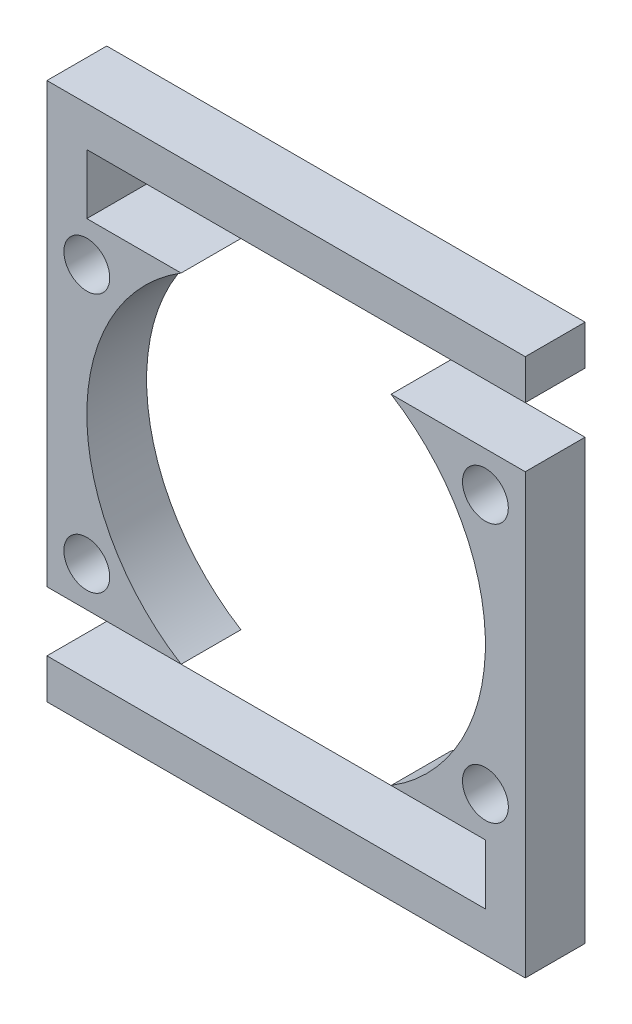
from build123d import *

# Parameters (mm, degrees)
SKETCH2_R             = 1.15
BOSS_EXTRUDE1_DEPTH   = 3
BOSS_EXTRUDE1_2_DEPTH = 3


with BuildPart() as part:
    # Sketch2 → Boss-Extrude1 (new body)
    with BuildSketch(Plane.XY):
        with BuildLine():
            Line((-12, -8.5), (-5.267826876, -8.5))
            ThreePointArc((-5.267826876, -8.5), (-10, 0), (-5.267826876, 8.5))
            Line((-5.267826876, 8.5), (-10, 8.5))
            Line((-10, 8.5), (-10, 11.5))
            Line((-10, 11.5), (12, 11.5))
            Line((12, 11.5), (12, 13.5))
            Line((12, 13.5), (-12, 13.5))
            Line((-12, 13.5), (-12, -8.5))
        make_face()
        with Locations((-10, -6.5)):
            Circle(SKETCH2_R, mode=Mode.SUBTRACT)
        with Locations((-10, 6.5)):
            Circle(SKETCH2_R, mode=Mode.SUBTRACT)
    extrude(amount=BOSS_EXTRUDE1_DEPTH)


with BuildPart() as body_2:
    # Sketch2 → Boss-Extrude1 2 (new body)
    with BuildSketch(Plane.XY):
        with BuildLine():
            Line((-12, -13.5), (12, -13.5))
            Line((12, -13.5), (12, 8.5))
            Line((12, 8.5), (5.267826876, 8.5))
            ThreePointArc((5.267826876, 8.5), (10, 0), (5.267826876, -8.5))
            Line((5.267826876, -8.5), (10, -8.5))
            Line((10, -8.5), (10, -11.5))
            Line((10, -11.5), (-12, -11.5))
            Line((-12, -11.5), (-12, -13.5))
        make_face()
        with Locations((10, 6.5)):
            Circle(SKETCH2_R, mode=Mode.SUBTRACT)
        with Locations((10, -6.5)):
            Circle(SKETCH2_R, mode=Mode.SUBTRACT)
    extrude(amount=BOSS_EXTRUDE1_2_DEPTH)


solid = Compound([part.part, body_2.part])
